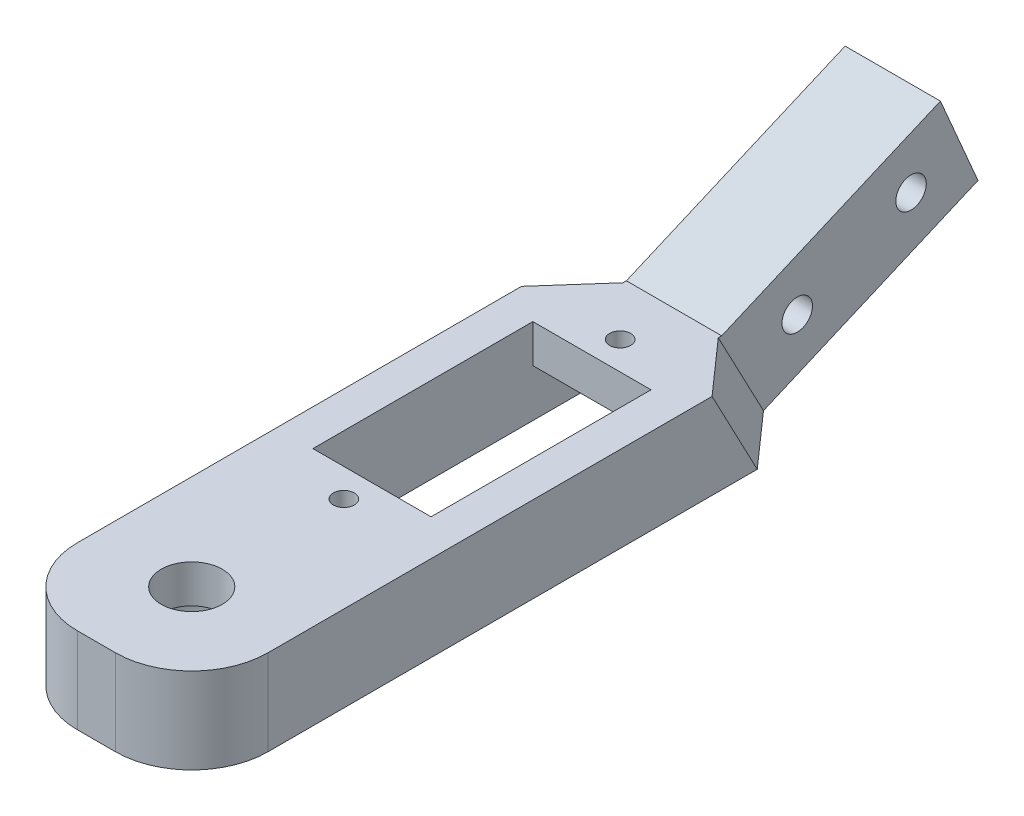
from build123d import *

# Parameters (mm, degrees)
EXTRUDE_1_DEPTH     = 10
SKETCH_2_R          = 6.7
CUT_EXTRUDE_1_DEPTH = 5
SKETCH_4_R          = 3.2
CUT_EXTRUDE_3_DEPTH = 57.124860802
SKETCH_3_W          = 12.4
SKETCH_3_H          = 23.085257288
CUT_EXTRUDE_2_DEPTH = 57.621550668
SKETCH_5_W          = 12.4
SKETCH_5_H          = 34.914742712
CUT_EXTRUDE_4_DEPTH = 5
SKETCH_6_R          = 1.1
CUT_EXTRUDE_5_DEPTH = 57.124860802
FILLET_1_R          = 8
SKETCH_9_R          = 1.6
EXTRUDE_2_DEPTH     = 5
CHAMFER_2_SIZE      = 5


with BuildPart() as part:
    # 草图1 → 凸台-拉伸1 (new, symmetric)
    with BuildSketch(Plane(origin=(0, 0, 0), x_dir=(0, 0, -1), z_dir=(1, 0, 0))):
        Polygon((55, -4), (50.256311045, 5), (-10, 5), (-10, -4), align=None)
    extrude(amount=EXTRUDE_1_DEPTH, both=True)

    # 草图2 → 切除-拉伸1 (cut)
    with BuildSketch(Plane(origin=(0, -4, 0), x_dir=(1, 0, 0), z_dir=(0, 1, 0))):
        with Locations(Location((0, 0, 0), (0, 0, 270))):
            Circle(SKETCH_2_R)
    extrude(amount=CUT_EXTRUDE_1_DEPTH, mode=Mode.SUBTRACT)

    # 草图4 → 切除-拉伸3 (cut, through all)
    with BuildSketch(Plane.XZ.offset(-1)):
        with Locations(Location((0, 0, 0), (0, 0, 270))):
            Circle(SKETCH_4_R)
    extrude(amount=-CUT_EXTRUDE_3_DEPTH, mode=Mode.SUBTRACT)

    # 草图3 → 切除-拉伸2 (cut, through all)
    with BuildSketch(Plane(origin=(0, 5, 0), x_dir=(1, 0, 0), z_dir=(0, 1, 0))):
        with Locations((0, 30.457371356)):
            Rectangle(SKETCH_3_W, SKETCH_3_H)
    extrude(amount=-CUT_EXTRUDE_2_DEPTH, mode=Mode.SUBTRACT)

    # 草图5 → 切除-拉伸4 (cut)
    with BuildSketch(Plane.XZ.offset(4)):
        with Locations((0, -30.457371356)):
            Rectangle(SKETCH_5_W, SKETCH_5_H)
    extrude(amount=-CUT_EXTRUDE_4_DEPTH, mode=Mode.SUBTRACT)

    # 草图6 → 切除-拉伸5 (cut, through all)
    with BuildSketch(Plane.XZ.offset(-1)):
        with Locations(Location((0, -15.957371356, 0), (0, 0, 270))):
            Circle(SKETCH_6_R)
        with Locations(Location((0, -44.957371356, 0), (0, 0, 90))):
            Circle(SKETCH_6_R)
    extrude(amount=-CUT_EXTRUDE_5_DEPTH, mode=Mode.SUBTRACT)

    # 圆角1
    fillet_1_edges = [part.edges().sort_by_distance(p)[0] for p in [
        (10, 0.5, 10),
        (-10, 0.5, 10),
    ]]
    fillet(fillet_1_edges, radius=FILLET_1_R)

    # 草图9 → 凸台-拉伸2 (add, symmetric)
    with BuildSketch(Plane(origin=(0, 0, 0), x_dir=(0, 0, -1), z_dir=(1, 0, 0))):
        Polygon((55, -4), (77.512583876, 5.666104035), (73.567235291, 14.85491378), (50.614909072, 5), (50.256311045, 5), align=None)
        with Locations((70.486064224, 8.090567185)):
            Circle(SKETCH_9_R, mode=Mode.SUBTRACT)
        with Locations((58.540611554, 2.961614024)):
            Circle(SKETCH_9_R, mode=Mode.SUBTRACT)
    extrude(amount=EXTRUDE_2_DEPTH, both=True)

    # 倒角2
    chamfer_2_edges = [part.edges().sort_by_distance(p)[0] for p in [
        (-10, 0.5, -52.628155522),
        (10, 0.5, -52.628155522),
    ]]
    chamfer(chamfer_2_edges, length=CHAMFER_2_SIZE - 0.0001)  # a hair under: the kernel refuses the full size


solid = part.part
